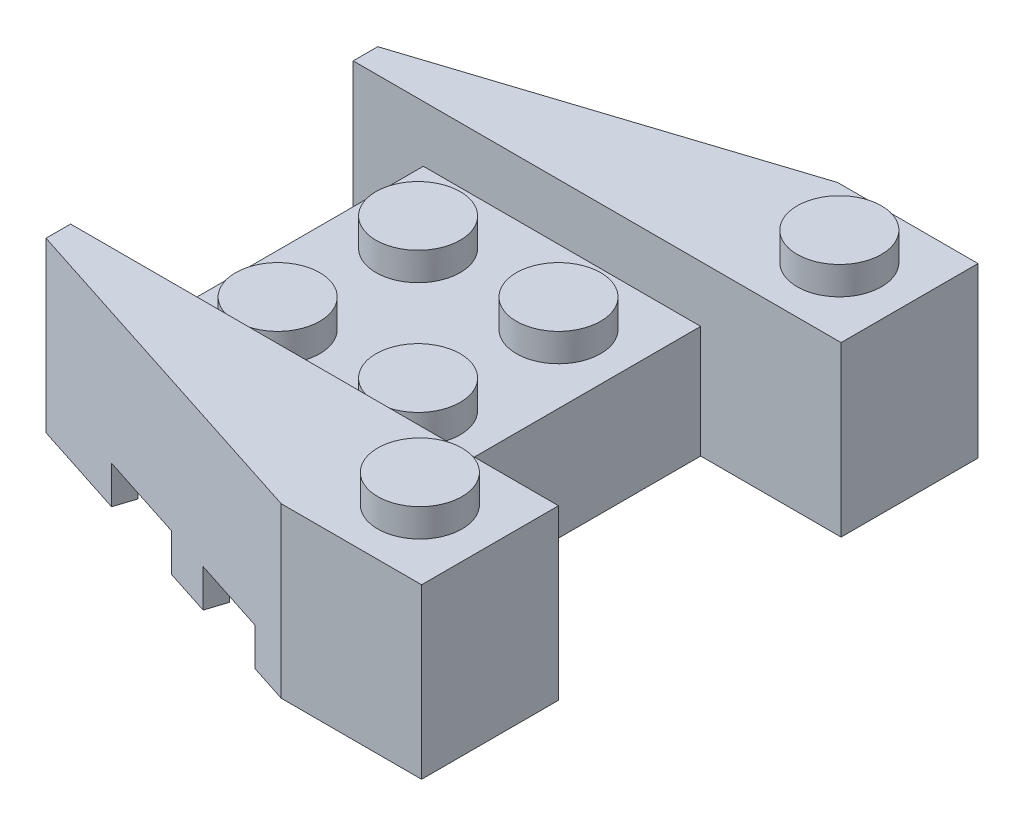
from build123d import *

# Parameters (mm, degrees)
SKETCH1_W             = 15.8
SKETCH1_H             = 6.4
BOSS_EXTRUDE1_DEPTH   = 16.1
SKETCH2_R             = 2.4
BOSS_EXTRUDE2_DEPTH   = 1.6
LPATTERN1_COUNT       = 3
LPATTERN1_PITCH       = 8
LPATTERN1_COUNT_DIR2  = 2
LPATTERN1_PITCH_DIR2  = 8
SHELL1_T              = -1.2
SKETCH3_R             = 3.25
SKETCH3_R_2           = 2.4
BOSS_EXTRUDE3_DEPTH   = 5
BOSS_EXTRUDE4_DEPTH   = 9.6
BOSS_EXTRUDE4_2_DEPTH = 9.6
SKETCH7_R             = 2.4
BOSS_EXTRUDE5_DEPTH   = 1.6
SPLIT1_OUTLINE_W      = 8
SPLIT1_OUTLINE_H      = 9.6
SPLIT1_DEPTH          = 7.8
SPLIT1_START          = 15.8
SPLIT1_2_OUTLINE_W    = 9.6
SPLIT1_2_OUTLINE_H    = 7.8
SPLIT1_2_DEPTH        = 8
SPLIT1_3_OUTLINE_W    = 8
SPLIT1_3_OUTLINE_H    = 7.8
SPLIT1_3_DEPTH        = 9.6
SPLIT1_START_2        = 9.6
SPLIT1_4_OUTLINE_R    = 2.4
SPLIT1_4_DEPTH        = 1.6
SPLIT1_5_OUTLINE_W    = 12.2
SPLIT1_5_OUTLINE_H    = 10
SPLIT1_5_DEPTH        = 8
SHELL2_T              = -1.2
SHELL3_T              = -1.2
SHELL4_T              = -1.2
SHELL5_T              = -1.2
CUT_EXTRUDE1_DEPTH    = 2.15


# Read off the part's stored shape, not the designer's step: Split1
with BuildPart() as part:
    # Sketch1 → Boss-Extrude1 (new body)
    with BuildSketch(Plane.XY):
        with Locations((7.9, 3.2)):
            Rectangle(SKETCH1_W, SKETCH1_H)
    extrude(amount=-BOSS_EXTRUDE1_DEPTH)

    # Sketch2 → Boss-Extrude2 (add)
    with BuildSketch(Plane(origin=(0, 6.4, 0), x_dir=(1, 0, 0), z_dir=(0, 1, 0))):
        with Locations(Location((3.9, 3.9, 0), (0, 0, 90))):
            Circle(SKETCH2_R)
    boss_extrude2 = extrude(amount=BOSS_EXTRUDE2_DEPTH)

    # LPattern1: Boss-Extrude2 3 × 2, 2 skipped
    with Locations(*[(i * LPATTERN1_PITCH, 0, -j * LPATTERN1_PITCH_DIR2) for i in range(LPATTERN1_COUNT) for j in range(LPATTERN1_COUNT_DIR2) if (i, j) not in ((0, 0), (2, 0), (2, 1))]):
        add(boss_extrude2)

    # Shell1
    shell1_openings = [part.faces().sort_by_distance(p)[0] for p in [
        (7.9, 0, -8.05),
    ]]
    offset(amount=SHELL1_T, openings=shell1_openings, kind=Kind.INTERSECTION)

    # Sketch3 → Boss-Extrude3 (add)
    with BuildSketch(Plane.XZ.offset(-5.2)):
        with Locations(Location((7.9, -7.9, 0), (0, 0, 90))):
            Circle(SKETCH3_R)
        with Locations(Location((7.9, -7.9, 0), (0, 0, 90))):
            Circle(SKETCH3_R_2, mode=Mode.SUBTRACT)
    extrude(amount=BOSS_EXTRUDE3_DEPTH)


with BuildPart() as body_2:
    # Sketch4 → Boss-Extrude4 (new body)
    with BuildSketch(Plane(origin=(0, 0, 0), x_dir=(-1, 0, 0), z_dir=(0, -1, 0))):
        Polygon((-15.8, 23.9), (4, 17.5), (4, 16.1), (0, 16.1), (-15.8, 16.1), (-23.8, 16.1), (-23.8, 23.9), align=None)
    extrude(amount=-BOSS_EXTRUDE4_DEPTH)

    # Sketch7 → Boss-Extrude5 (add)
    with BuildSketch(Plane(origin=(0, 9.6, 0), x_dir=(1, 0, 0), z_dir=(0, 1, 0))):
        with Locations(Location((19.8, 20, 0), (0, 0, 90))):
            Circle(SKETCH7_R)
        with Locations(Location((19.8, -3.9, 0), (0, 0, 90))):
            Circle(SKETCH7_R)
    extrude(amount=BOSS_EXTRUDE5_DEPTH)


with BuildPart() as body_3:
    # Sketch4 → Boss-Extrude4 2 (new body)
    with BuildSketch(Plane(origin=(0, 0, 0), x_dir=(-1, 0, 0), z_dir=(0, -1, 0))):
        Polygon((-23.8, -7.8), (-15.8, -7.8), (4, -1.4), (4, 0), (0, 0), (-15.8, 0), (-23.8, 0), align=None)
    extrude(amount=-BOSS_EXTRUDE4_2_DEPTH)

    # Split1 2 outline → Split1 2 (cut)
    with BuildSketch(Plane.YZ.offset(SPLIT1_START)):
        with Locations((4.8, 3.9)):
            Rectangle(SPLIT1_2_OUTLINE_W, SPLIT1_2_OUTLINE_H)
    extrude(amount=SPLIT1_2_DEPTH, mode=Mode.SUBTRACT)

    # Shell5
    shell5_openings = [body_3.faces().sort_by_distance(p)[0] for p in [
        (8.195652174, 0, 2.671014493),
    ]]
    offset(amount=SHELL5_T, openings=shell5_openings)


with BuildPart() as boss_extrude5_piece_1:
    # of the separate pieces the step leaves, piece 1, a body of its own (boss_extrude5_pieces)
    add(body_2.part.solids().sort_by_distance((15.8, 0, -23.9))[0])

    # Split1 5 outline → Split1 5 (cut)
    with BuildSketch(Plane.YZ.offset(SPLIT1_START)):
        with Locations((5.1, -20)):
            Rectangle(SPLIT1_5_OUTLINE_W, SPLIT1_5_OUTLINE_H)
    extrude(amount=SPLIT1_5_DEPTH, mode=Mode.SUBTRACT)

    # Shell3
    shell3_openings = [boss_extrude5_piece_1.faces().sort_by_distance(p)[0] for p in [
        (8.195652174, 0, -18.771014493),
    ]]
    offset(amount=SHELL3_T, openings=shell3_openings)


with BuildPart() as boss_extrude5_piece_2:
    # of the separate pieces the step leaves, piece 2, a body of its own (boss_extrude5_pieces)
    add(body_2.part.solids().sort_by_distance((19.8, 9.6, 1.5))[0])


with BuildPart() as body_5:
    # Split1 outline → Split1 (new body)
    with BuildSketch(Plane.XY):
        with Locations((19.8, 4.8)):
            Rectangle(SPLIT1_OUTLINE_W, SPLIT1_OUTLINE_H)
    extrude(amount=SPLIT1_DEPTH)

    # Shell4
    shell4_openings = [body_5.faces().sort_by_distance(p)[0] for p in [
        (19.8, 0, 3.9),
    ]]
    offset(amount=SHELL4_T, openings=shell4_openings, kind=Kind.INTERSECTION)


with BuildPart() as body_6:
    # Split1 3 outline → Split1 3 (new body)
    with BuildSketch(Plane(origin=(0, 0, 0), x_dir=(1, 0, 0), z_dir=(0, 1, 0))):
        with Locations((19.8, 20)):
            Rectangle(SPLIT1_3_OUTLINE_W, SPLIT1_3_OUTLINE_H)
    extrude(amount=SPLIT1_3_DEPTH)

    # Split1 4 outline → Split1 4 (add)
    with BuildSketch(Plane(origin=(0, 0, 0), x_dir=(1, 0, 0), z_dir=(0, 1, 0)).offset(SPLIT1_START_2)):
        with Locations((19.8, 20)):
            Circle(SPLIT1_4_OUTLINE_R)
    extrude(amount=SPLIT1_4_DEPTH)

    # Shell2
    shell2_openings = [body_6.faces().sort_by_distance(p)[0] for p in [
        (19.8, 0, -20),
    ]]
    offset(amount=SHELL2_T, openings=shell2_openings, kind=Kind.INTERSECTION)


with BuildPart() as part_1:
    add(part.part)

    # Combine1: union Boss-Extrude5 piece 1, body 6
    add(boss_extrude5_piece_1.part)
    add(body_6.part)


with BuildPart() as cut_extrude1_tool:
    # Sketch8 → Cut-Extrude1 (new body)
    with BuildSketch(Plane.XZ):
        Polygon((9.595306383, -20.63331204), (9.226229137, -21.775144772), (13.603254607, -23.189940883), (13.972331853, -22.048108152), align=None)
        Polygon((1.518858201, -19.283873358), (6.561952764, -20.91396453), (6.941436129, -19.775495393), (1.887935447, -18.142040627), align=None)
        Polygon((13.972331853, 5.948108152), (9.595306383, 4.53331204), (9.226229137, 5.675144772), (13.603254607, 7.089940883), align=None)
        Polygon((6.941436129, 3.675495393), (1.887935447, 2.042040627), (1.518858201, 3.183873358), (6.561952764, 4.81396453), align=None)
    extrude(amount=-CUT_EXTRUDE1_DEPTH)


with BuildPart() as part_2:
    add(part_1.part)

    # Cut-Extrude1: cut by cut_extrude1_tool
    add(cut_extrude1_tool.part, mode=Mode.SUBTRACT)


with BuildPart() as body_3_1:
    add(body_3.part)

    # Cut-Extrude1: cut by cut_extrude1_tool
    add(cut_extrude1_tool.part, mode=Mode.SUBTRACT)

    # Combine2: union body 5, part
    add(body_5.part)
    add(part_2.part)


solid = Compound([boss_extrude5_piece_2.part, body_3_1.part])
